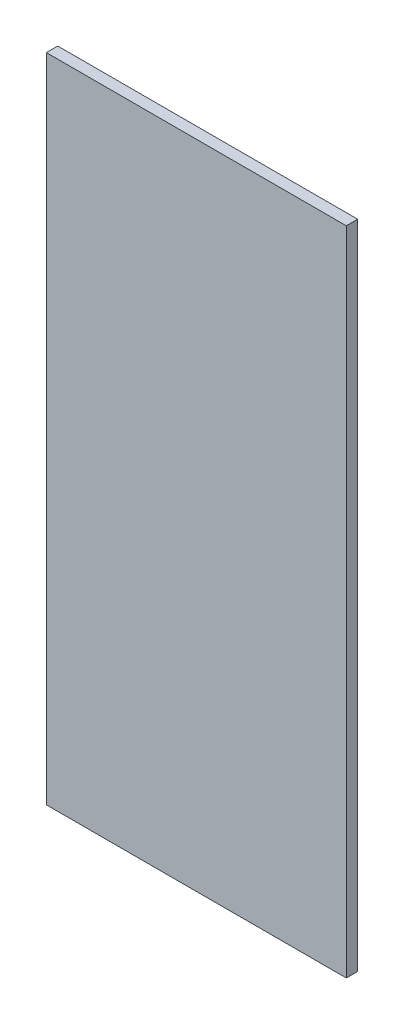
from build123d import *

# Parameters (mm, degrees)
SKETCH1_W           = 83.6
SKETCH1_H           = 181.55
BOSS_EXTRUDE1_DEPTH = 3.175


with BuildPart() as part:
    # Sketch1 → Boss-Extrude1 (new body)
    with BuildSketch(Plane.XY):
        Rectangle(SKETCH1_W, SKETCH1_H)
    extrude(amount=BOSS_EXTRUDE1_DEPTH)


solid = part.part
